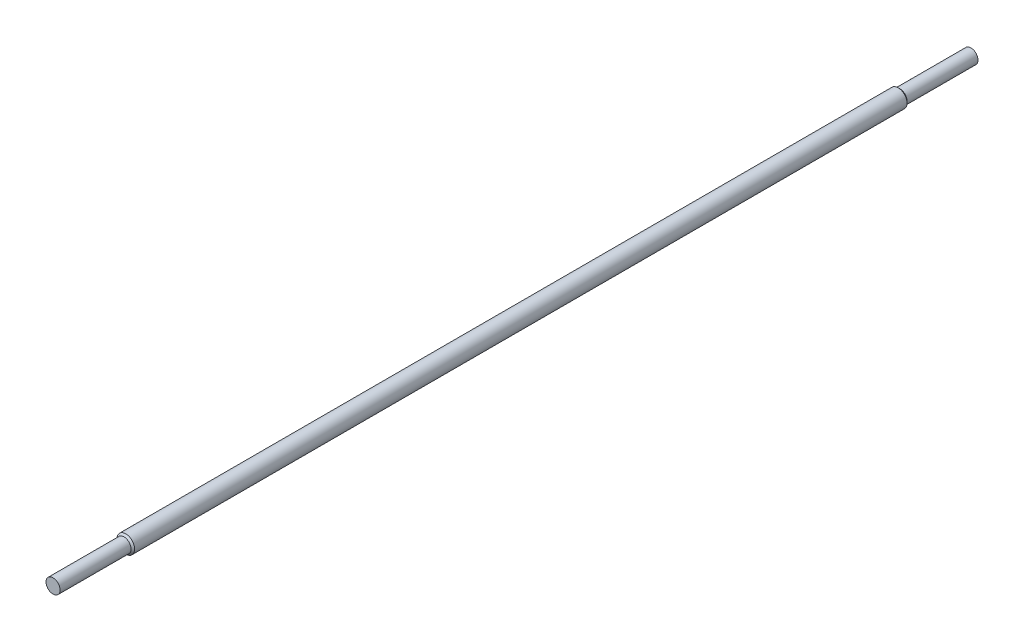
from build123d import *

# Parameters (mm, degrees)
SKETCH1_R           = 15.875
BOSS_EXTRUDE1_DEPTH = 825.5
SKETCH2_R           = 22.711063055
SKETCH2_R_2         = 12.7
CUT_EXTRUDE1_DEPTH  = 127
CHAMFER1_SIZE       = 3.81


with BuildPart() as part:
    # Sketch1 → Boss-Extrude1 (new, symmetric)
    with BuildSketch(Plane.XY):
        Circle(SKETCH1_R)
    extrude(amount=BOSS_EXTRUDE1_DEPTH, both=True)

    # Sketch2 → Cut-Extrude1 (cut)
    with BuildSketch(Plane.XY.offset(825.5)):
        Circle(SKETCH2_R)
        Circle(SKETCH2_R_2, mode=Mode.SUBTRACT)
    cut_extrude1 = extrude(amount=-CUT_EXTRUDE1_DEPTH, mode=Mode.SUBTRACT)

    # Mirror1: Cut-Extrude1 across plane
    add(cut_extrude1.mirror(Plane.XY), mode=Mode.SUBTRACT)

    # Chamfer1
    # the kernel refuses this chamfer: 3.81 mm, written as the material it takes off along each edge
    with BuildSketch(Plane(origin=(0, 0, -698.5), x_dir=(1, 0, 0), z_dir=(0, -1, 0))) as chamfer1_piece_1_section:
        Polygon((15.875, CHAMFER1_SIZE), (15.875 - CHAMFER1_SIZE, 0), (15.875, 0), align=None)
    chamfer1_piece_1 = revolve(axis=Axis((0, 0, -698.5), (0, 0, 1)), mode=Mode.PRIVATE)
    chamfer1_piece_1 = chamfer1_piece_1 - Plane(origin=(0, 0, -696.286679129), x_dir=(1, 0, 0), z_dir=(0, 0, -1)) * Cylinder(12.7, 64, mode=Mode.PRIVATE)
    add(chamfer1_piece_1, mode=Mode.SUBTRACT)
    with BuildSketch(Plane(origin=(0, 0, 698.5), x_dir=(1, 0, 0), z_dir=(0, -1, 0))) as chamfer1_piece_2_section:
        Polygon((15.875, -CHAMFER1_SIZE), (15.875 - CHAMFER1_SIZE, 0), (15.875, 0), align=None)
    chamfer1_piece_2 = revolve(axis=Axis((0, 0, 698.5), (0, 0, 1)), mode=Mode.PRIVATE)
    chamfer1_piece_2 = chamfer1_piece_2 - Plane(origin=(0, 0, 696.286679129), x_dir=(1, 0, 0), z_dir=(0, 0, 1)) * Cylinder(12.7, 64, mode=Mode.PRIVATE)
    add(chamfer1_piece_2, mode=Mode.SUBTRACT)


solid = part.part
